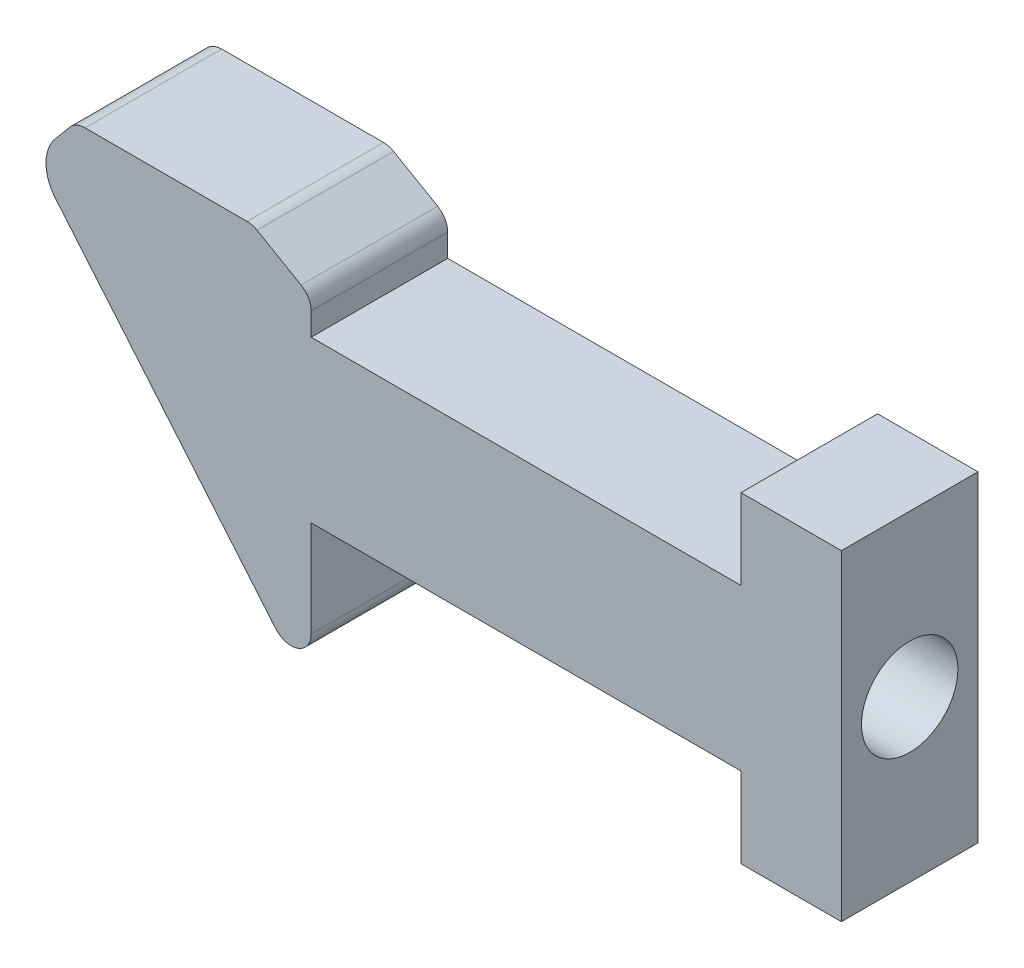
from build123d import *

# Parameters (mm, degrees)
BOSS_EXTRUDE3_DEPTH = 1.7
SKETCH3_R           = 0.95
CUT_EXTRUDE1_DEPTH  = 9.5
SKETCH4_R           = 1.2
CUT_EXTRUDE2_DEPTH  = 2.8


with BuildPart() as part:
    # Sketch2 → Boss-Extrude3 (new, symmetric)
    with BuildSketch(Plane.XY):
        with BuildLine():
            Line((-18.828250092, 3.7), (-14.796410162, 3.7))
            ThreePointArc((-14.796410162, 3.7), (-14.667000639, 3.682962913), (-14.546410162, 3.633012702))
            Line((-14.546410162, 3.633012702), (-13.45, 3))
            ThreePointArc((-13.45, 3), (-13.266987298, 2.816987298), (-13.2, 2.566987298))
            Line((-13.2, 2.566987298), (-13.2, 2))
            Line((-13.2, 2), (-2.5, 2))
            Line((-2.5, 2), (-2.5, 4))
            Line((-2.5, 4), (0, 4))
            Line((0, 4), (0, -4))
            Line((0, -4), (-2.5, -4))
            Line((-2.5, -4), (-2.5, -2))
            Line((-2.5, -2), (-13.2, -2))
            Line((-13.2, -2), (-13.2, -4.4))
            ThreePointArc((-13.2, -4.4), (-13.528989928, -4.86984631), (-14.083022222, -4.721393805))
            Line((-14.083022222, -4.721393805), (-19.566044443, 1.813017626))
            ThreePointArc((-19.566044443, 1.813017626), (-19.8, 2.455805236), (-19.566044443, 3.098592845))
            Line((-19.566044443, 3.098592845), (-19.211272314, 3.521393805))
            ThreePointArc((-19.211272314, 3.521393805), (-19.039559223, 3.653153894), (-18.828250092, 3.7))
        make_face()
    extrude(amount=BOSS_EXTRUDE3_DEPTH, both=True)

    # Sketch3 → Cut-Extrude1 (cut)
    with BuildSketch(Plane(origin=(0, 0, 0), x_dir=(0, 0, -1), z_dir=(1, 0, 0))):
        Circle(SKETCH3_R)
    extrude(amount=-CUT_EXTRUDE1_DEPTH, mode=Mode.SUBTRACT)

    # Sketch4 → Cut-Extrude2 (cut)
    with BuildSketch(Plane(origin=(0, 0, 0), x_dir=(0, 0, -1), z_dir=(1, 0, 0))):
        Circle(SKETCH4_R)
    extrude(amount=-CUT_EXTRUDE2_DEPTH, mode=Mode.SUBTRACT)


solid = part.part
